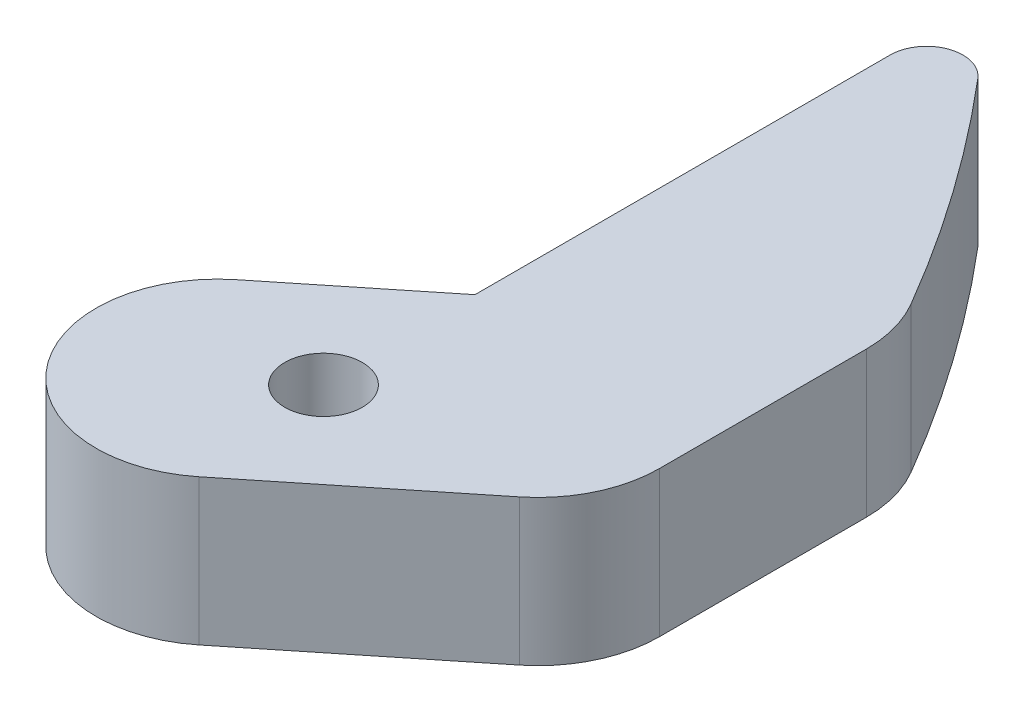
from build123d import *

# Parameters (mm, degrees)
ESBO_O1_R                = 1.6
RESSALTO_EXTRUS_O1_DEPTH = 6


with BuildPart() as part:
    # Esboço1 → Ressalto-extrusão1 (new body)
    with BuildSketch(Plane.XZ.offset(12)):
        with BuildLine():
            Line((-5.554408486, -1.950425304), (-0.098401843, -6.33585476))
            Line((-0.098401843, -6.33585476), (-0.098401843, -23.434191187))
            ThreePointArc((-0.098401843, -23.434191187), (0.884517689, -24.84224935), (2.545101876, -24.404963685))
            ThreePointArc((2.545101876, -24.404963685), (6.090429059, -19.835978921), (9.220727662, -14.973243345))
            ThreePointArc((9.220727662, -14.973243345), (9.728380083, -13.758965882), (9.901598157, -12.454291119))
            Line((9.901598157, -12.454291119), (9.901598157, -3.939806958))
            ThreePointArc((9.901598157, -3.939806958), (9.410602928, -1.779048764), (8.034047768, -0.042659356))
            Line((8.034047768, -0.042659356), (0.710490736, 5.843869901))
            ThreePointArc((0.710490736, 5.843869901), (-6.319106477, 5.07917191), (-5.554408486, -1.950425304))
        make_face()
        Circle(ESBO_O1_R, mode=Mode.SUBTRACT)
    extrude(amount=-RESSALTO_EXTRUS_O1_DEPTH)


solid = part.part
